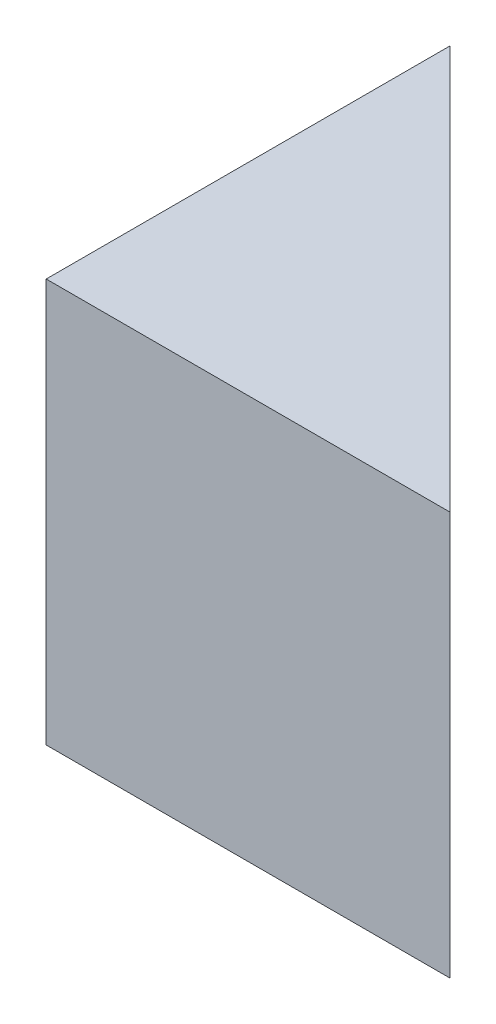
from build123d import *

# Parameters (mm, degrees)
BOSS_EXTRUDE1_DEPTH = 30


with BuildPart() as part:
    # Sketch1 → Boss-Extrude1 (new body)
    with BuildSketch(Plane(origin=(0, 0, 0), x_dir=(1, 0, 0), z_dir=(0, 1, 0))):
        Polygon((0, 0), (0, 30), (30, 0), align=None)
    extrude(amount=BOSS_EXTRUDE1_DEPTH)


solid = part.part
